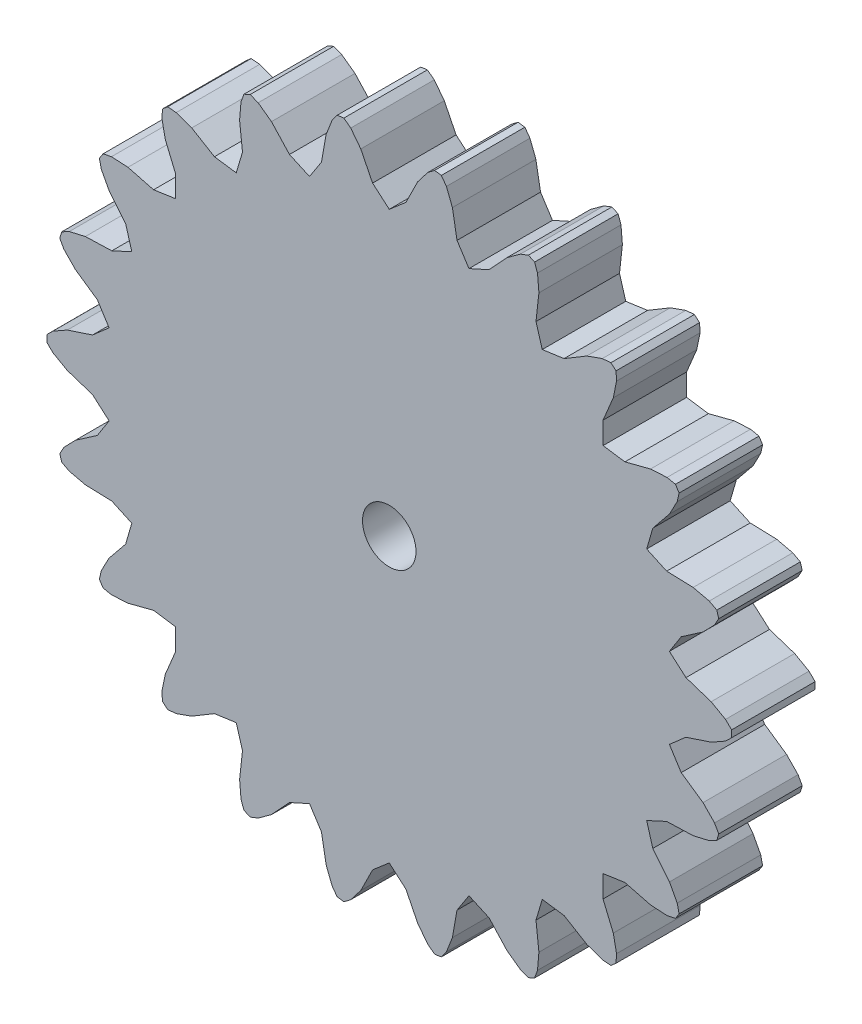
from build123d import *

# Parameters (mm, degrees)
SKETCH1_R               = 20.5
BOSS_EXTRUDE1_DEPTH     = 5
CUT_EXTRUDE1_DEPTH      = 30.419381367
CUT_EXTRUDE2_DEPTH      = 30.419381367
CUT_EXTRUDE2_DEPTH_BACK = 30.419381367
SKETCH4_R               = 1.6
CIRPATTERN1_COUNT       = 22


with BuildPart() as part:
    # Sketch1 → Boss-Extrude1 (new body)
    with BuildSketch(Plane.XY):
        Circle(SKETCH1_R)
    extrude(amount=BOSS_EXTRUDE1_DEPTH)

    # Sketch2 → Cut-Extrude1 (cut, through all)
    with BuildSketch(Plane.XY):
        Polygon((0, 16.944693036), (-0.998470792, 17.804120424), (-1.704297747, 19.225185361), (-2.306603416, 20.006300526), (-2.715384942, 20.31936723), (0, 24.503722989), (2.715384942, 20.31936723), (2.306603416, 20.006300526), (1.704297747, 19.225185361), (0.998470792, 17.804120424), align=None)
    cut_extrude1 = extrude(amount=CUT_EXTRUDE1_DEPTH, mode=Mode.SUBTRACT)

    # Sketch4 → Cut-Extrude2 (cut, two sides: drawn at the far end of the back side and taken through both)
    with BuildSketch(Plane.XY.offset(5).offset(-CUT_EXTRUDE2_DEPTH_BACK)):
        Circle(SKETCH4_R)
    extrude(amount=CUT_EXTRUDE2_DEPTH + CUT_EXTRUDE2_DEPTH_BACK, mode=Mode.SUBTRACT)

    # CirPattern1: Cut-Extrude1 ×22 about axis
    cirpattern1_axis = Axis((0, 0, 5), (0, 0, -1))
    for i in range(1, CIRPATTERN1_COUNT):
        add(cut_extrude1.rotate(cirpattern1_axis, i * 360 / CIRPATTERN1_COUNT), mode=Mode.SUBTRACT)


solid = part.part
